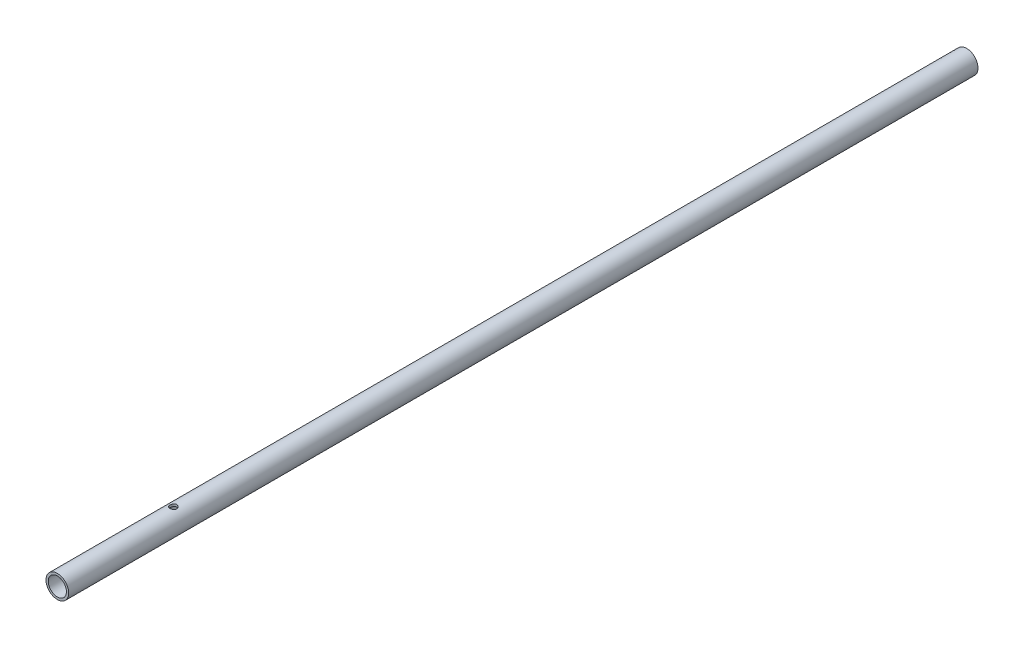
from build123d import *

# Parameters (mm, degrees)
SKETCH_1_R          = 5
SKETCH_1_R_2        = 4
EXTRUDE_1_DEPTH     = 400
SKETCH_2_R          = 1.5
CUT_EXTRUDE_1_DEPTH = 401.062495118
SKETCH_3_R          = 1.5
CUT_EXTRUDE_2_DEPTH = 401.062495221


with BuildPart() as part:
    # 草图1 → 凸台-拉伸1 (new body)
    with BuildSketch(Plane.XY):
        Circle(SKETCH_1_R)
        Circle(SKETCH_1_R_2, mode=Mode.SUBTRACT)
    extrude(amount=EXTRUDE_1_DEPTH)

    # 草图2 → 切除-拉伸1 (cut, through all)
    with BuildSketch(Plane(origin=(0, 0, 0), x_dir=(1, 0, 0), z_dir=(0, 1, 0))):
        with Locations((0, -31.334408431)):
            Circle(SKETCH_2_R)
    extrude(amount=-CUT_EXTRUDE_1_DEPTH, mode=Mode.SUBTRACT)

    # 草图3 → 切除-拉伸2 (cut, through all)
    with BuildSketch(Plane(origin=(0, 0, 0), x_dir=(1, 0, 0), z_dir=(0, 1, 0))):
        with Locations((0, -349)):
            Circle(SKETCH_3_R)
    extrude(amount=CUT_EXTRUDE_2_DEPTH, mode=Mode.SUBTRACT)


solid = part.part
